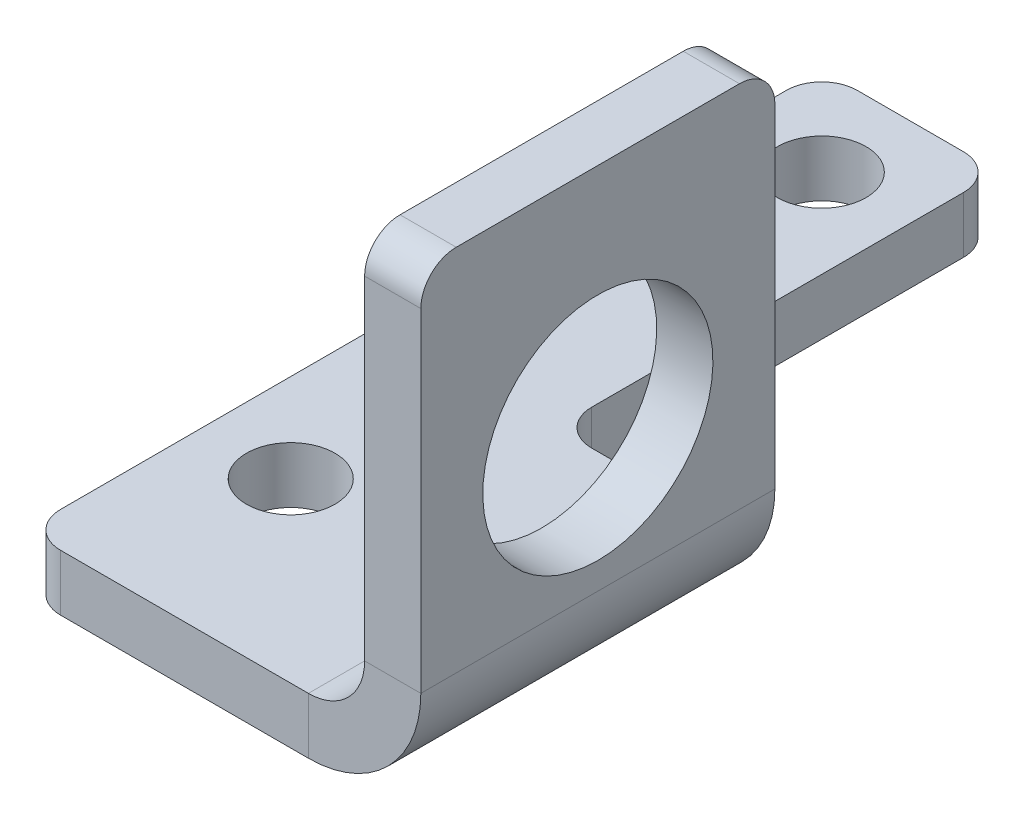
from build123d import *

# Parameters (mm, degrees)
SKETCH2_W           = 10
SKETCH2_H           = 45
BOSS_EXTRUDE1_DEPTH = 3.175
CUT_EXTRUDE1_REACH  = 48.207
SKETCH4_R           = 2.5
EDGE_FLANGE2_DEPTH  = 20
CUT_EXTRUDE2_REACH  = 57.957
SKETCH15_R          = 6.5
FILLET1_R           = 2


# Sheet-metal steps are written as plain solids
with BuildPart() as part:
    # Sketch2 → Boss-Extrude1 (new body)
    with BuildSketch(Plane(origin=(0, 0, 0), x_dir=(1, 0, 0), z_dir=(0, 1, 0))):
        with Locations((5, 22.5)):
            Rectangle(SKETCH2_W, SKETCH2_H)
    extrude(amount=BOSS_EXTRUDE1_DEPTH)

    # Sketch4 → Cut-Extrude1 (cut, up to next)
    with BuildSketch(Plane(origin=(0, 3.175, 0), x_dir=(1, 0, 0), z_dir=(0, 1, 0)), mode=Mode.PRIVATE) as cut_extrude1_sk1:
        with Locations(Location((5, 10, 0), (0, 0, 270))):
            Circle(SKETCH4_R)
    cut_extrude1_tool1 = extrude(cut_extrude1_sk1.sketch, amount=-CUT_EXTRUDE1_REACH, mode=Mode.PRIVATE) & part.part
    # Sketch4 → Cut-Extrude1 (cut, up to next)
    with BuildSketch(Plane(origin=(0, 3.175, 0), x_dir=(1, 0, 0), z_dir=(0, 1, 0)), mode=Mode.PRIVATE) as cut_extrude1_sk2:
        with Locations(Location((5, 40, 0), (0, 0, 270))):
            Circle(SKETCH4_R)
    cut_extrude1_tool2 = extrude(cut_extrude1_sk2.sketch, amount=-CUT_EXTRUDE1_REACH, mode=Mode.PRIVATE) & part.part
    add(cut_extrude1_tool1.solids().sort_by_distance((5, 3.175, -10))[0], mode=Mode.SUBTRACT)
    add(cut_extrude1_tool2.solids().sort_by_distance((5, 3.175, -40))[0], mode=Mode.SUBTRACT)

    # Edge-Flange2 section (across the edge) → Edge-Flange2 (add)
    with BuildSketch(Plane(origin=(19.175, 3.175, 0), x_dir=(-1, 0, 0), z_dir=(0, 0, -1))):
        with BuildLine():
            Line((-3.175, 3.175), (-3.175, 24))
            Line((-3.175, 24), (0, 24))
            Line((0, 24), (0, 3.175))
            ThreePointArc((0, 3.175), (0.92993597, 0.92993597), (3.175, 0))
            Line((3.175, 0), (9.175, 0))
            Line((9.175, 0), (9.175, -3.175))
            Line((9.175, -3.175), (3.175, -3.175))
            ThreePointArc((3.175, -3.175), (-1.315128061, -1.315128061), (-3.175, 3.175))
        make_face()
    extrude(amount=EDGE_FLANGE2_DEPTH)

    # Sketch15 → Cut-Extrude2 (cut, up to next)
    with BuildSketch(Plane.ZY.offset(-19.175), mode=Mode.PRIVATE) as cut_extrude2_sk1:
        with Locations(Location((-10, 14.35, 0), (0, 0, 270))):
            Circle(SKETCH15_R)
    cut_extrude2_tool1 = extrude(cut_extrude2_sk1.sketch, amount=-CUT_EXTRUDE2_REACH, mode=Mode.PRIVATE) & part.part
    add(cut_extrude2_tool1.solids().sort_by_distance((19.175, 14.35, -10))[0], mode=Mode.SUBTRACT)

    # Fillet1
    fillet1_edges = [part.edges().sort_by_distance(p)[0] for p in [
        (0, 1.5875, 0),
        (0, 1.5875, -45),
        (10, 1.5875, -45),
        (10, 1.5875, -20),
        (20.7625, 27.175, 0),
        (20.7625, 27.175, -20),
    ]]
    fillet(fillet1_edges, radius=FILLET1_R)


solid = part.part
